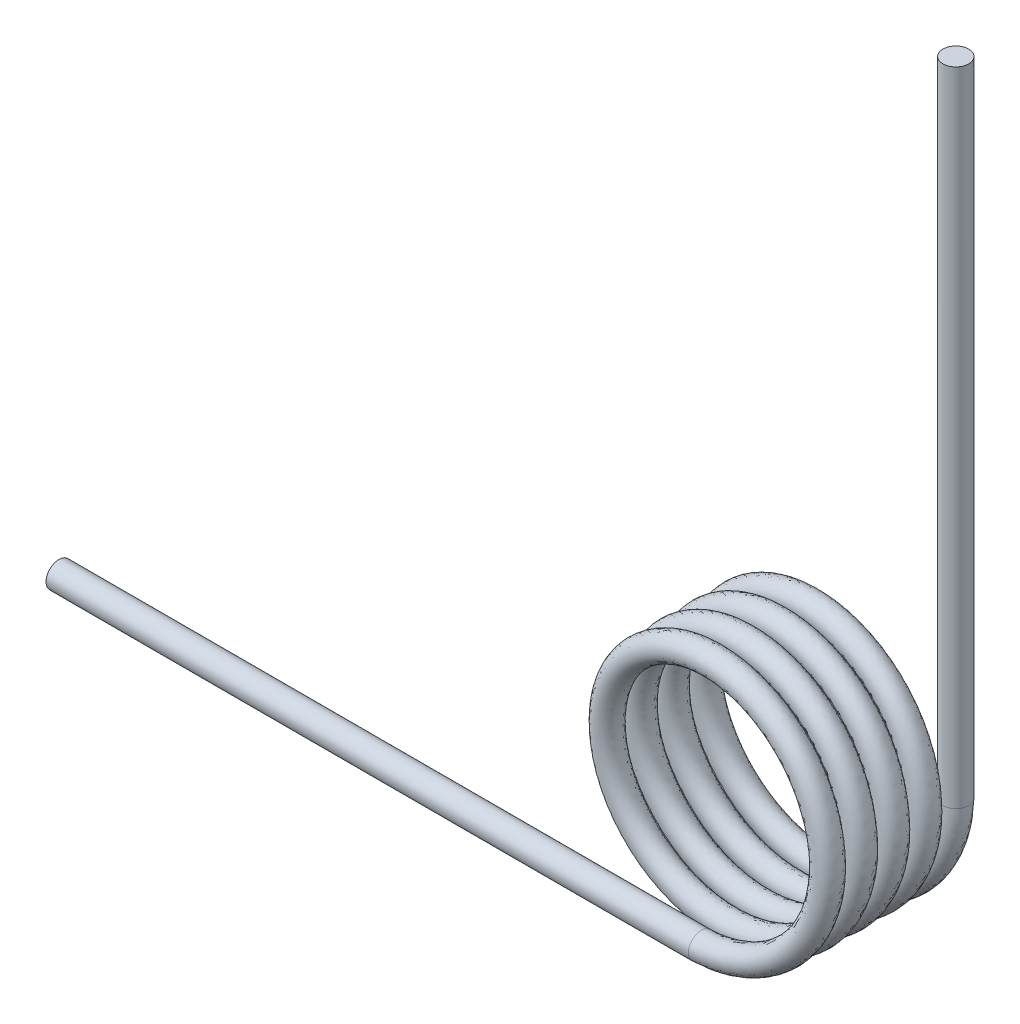
from build123d import *

# Parameters (mm, degrees)
BARRER2_PITCH           = 1
BARRER2_HEIGHT          = 4.25
BARRER2_RADIUS          = 3.675
CROQUIS7_R              = 0.4
CROQUIS8_R              = 0.4
SALIENTE_EXTRUIR1_DEPTH = 20
CROQUIS9_R              = 0.4
SALIENTE_EXTRUIR2_DEPTH = 20


with BuildPart() as part:
    # Barrer2: sweep along a helix
    with BuildLine() as barrer2_path:
        Helix(BARRER2_PITCH, BARRER2_HEIGHT, BARRER2_RADIUS, center=(0, 0, 0), direction=(0, 0, 1), lefthand=True)
    # Croquis7 → Barrer2 (sweep)
    with BuildSketch(Plane(origin=(0, 0, 0), x_dir=(0, 0, -1), z_dir=(1, 0, 0))):
        with Locations((-4.25, -3.675)):
            Circle(CROQUIS7_R)
    sweep(path=barrer2_path.line, is_frenet=True)

    # Croquis8 → Saliente-Extruir1 (add)
    with BuildSketch(Plane.ZY):
        with Locations(Location((4.25, -3.675, 0), (0, 0, 180))):
            Circle(CROQUIS8_R)
    extrude(amount=SALIENTE_EXTRUIR1_DEPTH)

    # Croquis9 → Saliente-Extruir2 (add)
    with BuildSketch(Plane(origin=(0, 0, 0), x_dir=(1, 0, 0), z_dir=(0, 1, 0))):
        with Locations(Location((3.675, 0, 0), (0, 0, 90))):
            Circle(CROQUIS9_R)
    extrude(amount=SALIENTE_EXTRUIR2_DEPTH)


solid = part.part
